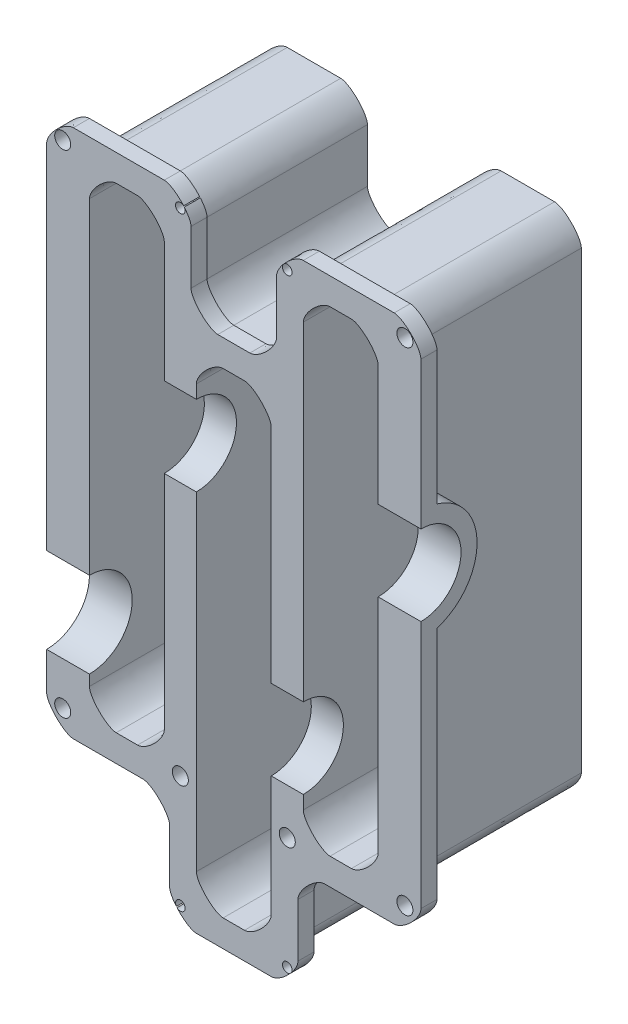
from build123d import *

# Parameters (mm, degrees)
SKETCH1_W           = 70
SKETCH1_H           = 119
BOSS_EXTRUDE1_DEPTH = 35
SKETCH2_R           = 8
CUT_EXTRUDE1_DEPTH  = 8
CUT_EXTRUDE2_DEPTH  = 32
SKETCH4_R           = 7.5
CUT_EXTRUDE3_DEPTH  = 8
SKETCH5_W           = 16
SKETCH5_H           = 20
SKETCH5_W_2         = 23
CUT_EXTRUDE4_DEPTH  = 78.396705356
CUT_EXTRUDE5_DEPTH  = 5
SKETCH8_W           = 18
SKETCH8_H           = 32
CUT_EXTRUDE6_DEPTH  = 2
SKETCH9_W           = 32
SKETCH9_H           = 22
CUT_EXTRUDE7_DEPTH  = 2
SKETCH10_W          = 22
SKETCH10_H          = 32
CUT_EXTRUDE8_DEPTH  = 2
SKETCH11_W          = 32
SKETCH11_H          = 18
CUT_EXTRUDE9_DEPTH  = 2
SKETCH12_W          = 25
SKETCH12_H          = 32
CUT_EXTRUDE10_DEPTH = 2
CUT_EXTRUDE11_DEPTH = 5
SKETCH14_W          = 22
SKETCH14_H          = 32
CUT_EXTRUDE12_DEPTH = 2
SKETCH15_W          = 22
SKETCH15_H          = 32
CUT_EXTRUDE13_DEPTH = 2
SKETCH16_W          = 16
SKETCH16_H          = 32
CUT_EXTRUDE14_DEPTH = 2
SKETCH17_W          = 32
SKETCH17_H          = 20
CUT_EXTRUDE15_DEPTH = 2
SKETCH18_W          = 32
SKETCH18_H          = 20
CUT_EXTRUDE17_DEPTH = 2
FILLET3_SIZE        = 5
FILLET5_SIZE        = 5
FILLET6_SIZE        = 5
FILLET7_START       = -1
FILLET7_DEPTH       = 33
FILLET7_2_DEPTH     = 32
FILLET11_SIZE       = 5
FILLET12_START      = 32
FILLET12_DEPTH      = 3
FILLET12_2_DEPTH    = 3
SKETCH19_R          = 1.5
CUT_EXTRUDE18_DEPTH = 10
SKETCH20_R          = 0.9
CUT_EXTRUDE19_DEPTH = 10
BOSS_EXTRUDE2_START = -6
BOSS_EXTRUDE2_DEPTH = 6
BOSS_EXTRUDE3_DEPTH = 6


with BuildPart() as part:
    # Sketch1 → Boss-Extrude1 (new body)
    with BuildSketch(Plane.XY):
        Rectangle(SKETCH1_W, SKETCH1_H)
    extrude(amount=BOSS_EXTRUDE1_DEPTH)

    # Sketch2 → Cut-Extrude1 (cut)
    with BuildSketch(Plane.ZY.offset(35)):
        with Locations((35, -19.5)):
            Circle(SKETCH2_R)
    extrude(amount=-CUT_EXTRUDE1_DEPTH, mode=Mode.SUBTRACT)

    # Sketch3 → Cut-Extrude2 (cut)
    with BuildSketch(Plane.XY.offset(35)):
        Polygon((-27, 54.5), (-13, 54.5), (-13, 27), (-7, 27), (-7, 34.5), (7, 34.5), (7, -12), (13, -12), (13, 54.5), (27, 54.5), (27, -34.5), (13, -34.5), (13, -27), (7, -27), (7, -54.5), (-7, -54.5), (-7, 12), (-13, 12), (-13, -34.5), (-27, -34.5), align=None)
    extrude(amount=-CUT_EXTRUDE2_DEPTH, mode=Mode.SUBTRACT)

    # Sketch4 → Cut-Extrude3 (cut)
    with BuildSketch(Plane(origin=(35, 0, 0), x_dir=(0, 0, -1), z_dir=(1, 0, 0))):
        with Locations((-35, 19.5)):
            Circle(SKETCH4_R)
    extrude(amount=-CUT_EXTRUDE3_DEPTH, mode=Mode.SUBTRACT)

    # Sketch5 → Cut-Extrude4 (cut, through all)
    with BuildSketch(Plane.XY.offset(35)):
        with Locations((0, 49.5)):
            Rectangle(SKETCH5_W, SKETCH5_H)
        with Locations((-23.5, -49.5)):
            Rectangle(SKETCH5_W_2, SKETCH5_H)
        with Locations((23.5, -49.5)):
            Rectangle(SKETCH5_W_2, SKETCH5_H)
    extrude(amount=-CUT_EXTRUDE4_DEPTH, mode=Mode.SUBTRACT)

    # Sketch7 → Cut-Extrude5 (cut)
    with BuildSketch(Plane.ZY.offset(35)):
        with BuildLine():
            Line((32, 59.5), (0, 59.5))
            Line((0, 59.5), (0, -39.5))
            Line((0, -39.5), (32, -39.5))
            Line((32, -39.5), (32, -30.083005244))
            ThreePointArc((32, -30.083005244), (24, -19.5), (32, -8.916994756))
            Line((32, -8.916994756), (32, 59.5))
        make_face()
    extrude(amount=-CUT_EXTRUDE5_DEPTH, mode=Mode.SUBTRACT)

    # Sketch8 → Cut-Extrude6 (cut)
    with BuildSketch(Plane.XZ.offset(39.5)):
        with Locations((-21, 16)):
            Rectangle(SKETCH8_W, SKETCH8_H)
    extrude(amount=-CUT_EXTRUDE6_DEPTH, mode=Mode.SUBTRACT)

    # Sketch9 → Cut-Extrude7 (cut)
    with BuildSketch(Plane.ZY.offset(12)):
        with Locations((16, -48.5)):
            Rectangle(SKETCH9_W, SKETCH9_H)
    extrude(amount=-CUT_EXTRUDE7_DEPTH, mode=Mode.SUBTRACT)

    # Sketch10 → Cut-Extrude8 (cut)
    with BuildSketch(Plane.XZ.offset(59.5)):
        with Locations((1, 16)):
            Rectangle(SKETCH10_W, SKETCH10_H)
    extrude(amount=-CUT_EXTRUDE8_DEPTH, mode=Mode.SUBTRACT)

    # Sketch11 → Cut-Extrude9 (cut)
    with BuildSketch(Plane(origin=(12, 0, 0), x_dir=(0, 0, -1), z_dir=(1, 0, 0))):
        with Locations((-16, -48.5)):
            Rectangle(SKETCH11_W, SKETCH11_H)
    extrude(amount=-CUT_EXTRUDE9_DEPTH, mode=Mode.SUBTRACT)

    # Sketch12 → Cut-Extrude10 (cut)
    with BuildSketch(Plane.XZ.offset(39.5)):
        with Locations((22.5, 16)):
            Rectangle(SKETCH12_W, SKETCH12_H)
    extrude(amount=-CUT_EXTRUDE10_DEPTH, mode=Mode.SUBTRACT)

    # Sketch13 → Cut-Extrude11 (cut)
    with BuildSketch(Plane(origin=(35, 0, 0), x_dir=(0, 0, -1), z_dir=(1, 0, 0))):
        with BuildLine():
            Line((0, -37.5), (-32, -37.5))
            Line((-32, -37.5), (-32, 9.437694101))
            ThreePointArc((-32, 9.437694101), (-24.5, 19.5), (-32, 29.562305899))
            Line((-32, 29.562305899), (-32, 59.5))
            Line((-32, 59.5), (0, 59.5))
            Line((0, 59.5), (0, -37.5))
        make_face()
    extrude(amount=-CUT_EXTRUDE11_DEPTH, mode=Mode.SUBTRACT)

    # Sketch14 → Cut-Extrude12 (cut)
    with BuildSketch(Plane(origin=(0, 59.5, 0), x_dir=(1, 0, 0), z_dir=(0, 1, 0))):
        with Locations((19, -16)):
            Rectangle(SKETCH14_W, SKETCH14_H)
    extrude(amount=-CUT_EXTRUDE12_DEPTH, mode=Mode.SUBTRACT)

    # Sketch15 → Cut-Extrude13 (cut)
    with BuildSketch(Plane(origin=(0, 59.5, 0), x_dir=(1, 0, 0), z_dir=(0, 1, 0))):
        with Locations((-19, -16)):
            Rectangle(SKETCH15_W, SKETCH15_H)
    extrude(amount=-CUT_EXTRUDE13_DEPTH, mode=Mode.SUBTRACT)

    # Sketch16 → Cut-Extrude14 (cut)
    with BuildSketch(Plane(origin=(0, 39.5, 0), x_dir=(1, 0, 0), z_dir=(0, 1, 0))):
        with Locations((0, -16)):
            Rectangle(SKETCH16_W, SKETCH16_H)
    extrude(amount=-CUT_EXTRUDE14_DEPTH, mode=Mode.SUBTRACT)

    # Sketch17 → Cut-Extrude15 (cut)
    with BuildSketch(Plane.ZY.offset(-8)):
        with Locations((16, 47.5)):
            Rectangle(SKETCH17_W, SKETCH17_H)
    extrude(amount=-CUT_EXTRUDE15_DEPTH, mode=Mode.SUBTRACT)

    # Sketch18 → Cut-Extrude17 (cut)
    with BuildSketch(Plane(origin=(-8, 0, 0), x_dir=(0, 0, -1), z_dir=(1, 0, 0))):
        with Locations((-16, 47.5)):
            Rectangle(SKETCH18_W, SKETCH18_H)
    extrude(amount=-CUT_EXTRUDE17_DEPTH, mode=Mode.SUBTRACT)

    # Fillet3
    # a fillet whose section is not a circle: 5 mm, written as the material it adds along each edge
    with BuildSketch(Plane(origin=(13, 54.5, 35), x_dir=(1, 0, 0), z_dir=(0, 0, -1)), Plane(origin=(-7, 34.5, 35), x_dir=(1, 0, 0), z_dir=(0, 0, -1))) as fillet3_piece_1:
        with BuildLine():
            Bezier((FILLET3_SIZE, 0), (0, 0), (0, FILLET3_SIZE), weights=[1, 0.353553391, 1])
            Line((0, FILLET3_SIZE), (0, 0))
            Line((0, 0), (FILLET3_SIZE, 0))
        make_face()
    extrude(amount=32)
    with BuildSketch(Plane(origin=(-27, 54.5, 35), x_dir=(0, -1, 0), z_dir=(0, 0, -1))) as fillet3_piece_2:
        with BuildLine():
            Bezier((FILLET3_SIZE, 0), (0, 0), (0, -FILLET3_SIZE), weights=[1, 0.353553391, 1])
            Line((0, -FILLET3_SIZE), (0, 0))
            Line((0, 0), (FILLET3_SIZE, 0))
        make_face()
    extrude(amount=32)

    # Fillet5
    # a fillet whose section is not a circle: 5 mm, written as the material it adds along each edge
    with BuildSketch(Plane(origin=(27, 54.5, 35), x_dir=(0, -1, 0), z_dir=(0, 0, -1)), Plane(origin=(7, 34.5, 35), x_dir=(0, -1, 0), z_dir=(0, 0, -1))) as fillet5_piece_1:
        with BuildLine():
            Bezier((FILLET5_SIZE, 0), (0, 0), (0, FILLET5_SIZE), weights=[1, 0.353553391, 1])
            Line((0, FILLET5_SIZE), (0, 0))
            Line((0, 0), (FILLET5_SIZE, 0))
        make_face()
    extrude(amount=32)
    with BuildSketch(Plane(origin=(-13, 54.5, 35), x_dir=(-1, 0, 0), z_dir=(0, 0, -1))) as fillet5_piece_2:
        with BuildLine():
            Bezier((FILLET5_SIZE, 0), (0, 0), (0, -FILLET5_SIZE), weights=[1, 0.353553391, 1])
            Line((0, -FILLET5_SIZE), (0, 0))
            Line((0, 0), (FILLET5_SIZE, 0))
        make_face()
    extrude(amount=32)

    # Fillet6
    # a fillet whose section is not a circle: 5 mm, written as the material it adds along each edge
    with BuildSketch(Plane(origin=(27, -34.5, 35), x_dir=(-1, 0, 0), z_dir=(0, 0, -1)), Plane(origin=(13, -34.5, 35), x_dir=(0, 1, 0), z_dir=(0, 0, -1)), Plane(origin=(7, -54.5, 35), x_dir=(-1, 0, 0), z_dir=(0, 0, -1)), Plane(origin=(-7, -54.5, 35), x_dir=(0, 1, 0), z_dir=(0, 0, -1)), Plane(origin=(-13, -34.5, 35), x_dir=(-1, 0, 0), z_dir=(0, 0, -1)), Plane(origin=(-27, -34.5, 35), x_dir=(0, 1, 0), z_dir=(0, 0, -1))) as fillet6_piece_1:
        with BuildLine():
            Bezier((FILLET6_SIZE, 0), (0, 0), (0, FILLET6_SIZE), weights=[1, 0.353553391, 1])
            Line((0, FILLET6_SIZE), (0, 0))
            Line((0, 0), (FILLET6_SIZE, 0))
        make_face()
    extrude(amount=32)

    # Fillet7: read off the stored shape, not the designer's step
    # Fillet7 outline → Fillet7 (cut)
    with BuildSketch(Plane.XY.offset(FILLET7_START)):
        with BuildLine():
            Line((-10, 57.5), (-15, 57.5))
            add(Edge.make_bspline(
                [(-15, 57.5), (-10, 57.5), (-10, 52.5)],
                knots=[0, 0, 0, 1, 1, 1], degree=2, weights=[1, 0.353553391, 1]))
            Line((-10, 52.5), (-10, 57.5))
        make_face()
        with BuildLine():
            add(Edge.make_bspline(
                [(-30, 52.5), (-30, 57.5), (-25, 57.5)],
                knots=[0, 0, 0, 1, 1, 1], degree=2, weights=[1, 0.353553391, 1]))
            Line((-25, 57.5), (-30, 57.5))
            Line((-30, 57.5), (-30, 52.5))
        make_face()
        with BuildLine():
            add(Edge.make_bspline(
                [(-25, -37.5), (-30, -37.5), (-30, -32.5)],
                knots=[0, 0, 0, 1, 1, 1], degree=2, weights=[1, 0.353553391, 1]))
            Line((-30, -32.5), (-30, -37.5))
            Line((-30, -37.5), (-25, -37.5))
        make_face()
        with BuildLine():
            Line((10, 57.5), (10, 52.5))
            add(Edge.make_bspline(
                [(10, 52.5), (10, 57.5), (15, 57.5)],
                knots=[0, 0, 0, 1, 1, 1], degree=2, weights=[1, 0.353553391, 1]))
            Line((15, 57.5), (10, 57.5))
        make_face()
        with BuildLine():
            add(Edge.make_bspline(
                [(-10, -52.5), (-10, -57.5), (-5, -57.5)],
                knots=[0, 0, 0, 1, 1, 1], degree=2, weights=[1, 0.353553391, 1]))
            Line((-10, -52.5), (-10, -57.5))
            Line((-10, -57.5), (-5, -57.5))
        make_face()
        with BuildLine():
            Line((30, 57.5), (25, 57.5))
            add(Edge.make_bspline(
                [(25, 57.5), (30, 57.5), (30, 52.5)],
                knots=[0, 0, 0, 1, 1, 1], degree=2, weights=[1, 0.353553391, 1]))
            Line((30, 52.5), (30, 57.5))
        make_face()
        with BuildLine():
            add(Edge.make_bspline(
                [(5, -57.5), (10, -57.5), (10, -52.5)],
                knots=[0, 0, 0, 1, 1, 1], degree=2, weights=[1, 0.353553391, 1]))
            Line((5, -57.5), (10, -57.5))
            Line((10, -57.5), (10, -52.5))
        make_face()
        with BuildLine():
            Line((30, -37.5), (30, -32.5))
            add(Edge.make_bspline(
                [(30, -32.5), (30, -37.5), (25, -37.5)],
                knots=[0, 0, 0, 1, 1, 1], degree=2, weights=[1, 0.353553391, 1]))
            Line((25, -37.5), (30, -37.5))
        make_face()
    extrude(amount=FILLET7_DEPTH, mode=Mode.SUBTRACT)

    # Fillet7 2 outline → Fillet7 2 (add)
    with BuildSketch(Plane.XY):
        with BuildLine():
            add(Edge.make_bspline(
                [(-5, 37.5), (-10, 37.5), (-10, 42.5)],
                knots=[0, 0, 0, 1, 1, 1], degree=2, weights=[1, 0.353553391, 1]))
            Line((-10, 42.5), (-10, 37.5))
            Line((-10, 37.5), (-5, 37.5))
        make_face()
        with BuildLine():
            add(Edge.make_bspline(
                [(5, 37.5), (10, 37.5), (10, 42.5)],
                knots=[0, 0, 0, 1, 1, 1], degree=2, weights=[1, 0.353553391, 1]))
            Line((5, 37.5), (10, 37.5))
            Line((10, 37.5), (10, 42.5))
        make_face()
        with BuildLine():
            Line((-10, -37.5), (-15, -37.5))
            add(Edge.make_bspline(
                [(-10, -42.5), (-10, -37.5), (-15, -37.5)],
                knots=[0, 0, 0, 1, 1, 1], degree=2, weights=[1, 0.353553391, 1]))
            Line((-10, -42.5), (-10, -37.5))
        make_face()
        with BuildLine():
            Line((10, -37.5), (10, -42.5))
            add(Edge.make_bspline(
                [(15, -37.5), (10, -37.5), (10, -42.5)],
                knots=[0, 0, 0, 1, 1, 1], degree=2, weights=[1, 0.353553391, 1]))
            Line((15, -37.5), (10, -37.5))
        make_face()
    extrude(amount=FILLET7_2_DEPTH)

    # Fillet11
    # a fillet whose section is not a circle: 5 mm, written as the material it takes off along each edge
    with BuildSketch(Plane(origin=(35, -39.5, 47.5), x_dir=(0, 1, 0), z_dir=(0, 0, -1))) as fillet11_piece_1:
        with BuildLine():
            Bezier((FILLET11_SIZE, 0), (0, 0), (0, -FILLET11_SIZE), weights=[1, 0.353553391, 1])
            Line((0, -FILLET11_SIZE), (0, 0))
            Line((0, 0), (FILLET11_SIZE, 0))
        make_face()
    extrude(amount=28, mode=Mode.SUBTRACT)

    # Fillet12: read off the stored shape, not the designer's step
    # Fillet12 outline → Fillet12 (cut)
    with BuildSketch(Plane.XY.offset(FILLET12_START)):
        with BuildLine():
            Line((35, 59.5), (30, 59.5))
            add(Edge.make_bspline(
                [(30, 59.5), (35, 59.5), (35, 54.5)],
                knots=[0, 0, 0, 1, 1, 1], degree=2, weights=[1, 0.353553391, 1]))
            Line((35, 54.5), (35, 59.5))
        make_face()
        with BuildLine():
            Line((8, 59.5), (8, 54.5))
            add(Edge.make_bspline(
                [(13, 59.5), (8, 59.5), (8, 54.5)],
                knots=[0, 0, 0, 1, 1, 1], degree=2, weights=[1, 0.353553391, 1]))
            Line((13, 59.5), (8, 59.5))
        make_face()
        with BuildLine():
            add(Edge.make_bspline(
                [(7, -59.5), (12, -59.5), (12, -54.5)],
                knots=[0, 0, 0, 1, 1, 1], degree=2, weights=[1, 0.353553391, 1]))
            Line((7, -59.5), (12, -59.5))
            Line((12, -59.5), (12, -54.5))
        make_face()
        with BuildLine():
            add(Edge.make_bspline(
                [(-12, -54.5), (-12, -59.5), (-7, -59.5)],
                knots=[0, 0, 0, 1, 1, 1], degree=2, weights=[1, 0.353553391, 1]))
            Line((-12, -54.5), (-12, -59.5))
            Line((-12, -59.5), (-7, -59.5))
        make_face()
        with BuildLine():
            add(Edge.make_bspline(
                [(-35, -34.5), (-35, -39.5), (-30, -39.5)],
                knots=[0, 0, 0, 1, 1, 1], degree=2, weights=[1, 0.353553391, 1]))
            Line((-35, -34.5), (-35, -39.5))
            Line((-35, -39.5), (-30, -39.5))
        make_face()
        with BuildLine():
            add(Edge.make_bspline(
                [(-35, 54.5), (-35, 59.5), (-30, 59.5)],
                knots=[0, 0, 0, 1, 1, 1], degree=2, weights=[1, 0.353553391, 1]))
            Line((-30, 59.5), (-35, 59.5))
            Line((-35, 59.5), (-35, 54.5))
        make_face()
        with BuildLine():
            add(Edge.make_bspline(
                [(-8, 54.5), (-8, 59.5), (-13, 59.5)],
                knots=[0, 0, 0, 1, 1, 1], degree=2, weights=[1, 0.353553391, 1]))
            Line((-8, 54.5), (-8, 59.5))
            Line((-8, 59.5), (-13, 59.5))
        make_face()
    extrude(amount=FILLET12_DEPTH, mode=Mode.SUBTRACT)

    # Fillet12 2 outline → Fillet12 2 (add)
    with BuildSketch(Plane.XY.offset(FILLET12_START)):
        with BuildLine():
            add(Edge.make_bspline(
                [(3, 39.5), (8, 39.5), (8, 44.5)],
                knots=[0, 0, 0, 1, 1, 1], degree=2, weights=[1, 0.353553391, 1]))
            Line((3, 39.5), (8, 39.5))
            Line((8, 39.5), (8, 44.5))
        make_face()
        with BuildLine():
            Line((12, -39.5), (12, -44.5))
            add(Edge.make_bspline(
                [(17, -39.5), (12, -39.5), (12, -44.5)],
                knots=[0, 0, 0, 1, 1, 1], degree=2, weights=[1, 0.353553391, 1]))
            Line((17, -39.5), (12, -39.5))
        make_face()
        with BuildLine():
            Line((-12, -39.5), (-17, -39.5))
            add(Edge.make_bspline(
                [(-12, -44.5), (-12, -39.5), (-17, -39.5)],
                knots=[0, 0, 0, 1, 1, 1], degree=2, weights=[1, 0.353553391, 1]))
            Line((-12, -44.5), (-12, -39.5))
        make_face()
        with BuildLine():
            add(Edge.make_bspline(
                [(-8, 44.5), (-8, 39.5), (-3, 39.5)],
                knots=[0, 0, 0, 1, 1, 1], degree=2, weights=[1, 0.353553391, 1]))
            Line((-8, 44.5), (-8, 39.5))
            Line((-8, 39.5), (-3, 39.5))
        make_face()
    extrude(amount=FILLET12_2_DEPTH)

    # Sketch19 → Cut-Extrude18 (cut)
    with BuildSketch(Plane.XY.offset(35)):
        with Locations((-32, 56.5)):
            Circle(SKETCH19_R)
        with Locations((32, 56.5)):
            Circle(SKETCH19_R)
        with Locations((32, -35.5)):
            Circle(SKETCH19_R)
        with Locations((-32, -35.5)):
            Circle(SKETCH19_R)
        with Locations((-10, -35.5)):
            Circle(SKETCH19_R)
        with Locations((10, -35.5)):
            Circle(SKETCH19_R)
    extrude(amount=-CUT_EXTRUDE18_DEPTH, mode=Mode.SUBTRACT)

    # Sketch20 → Cut-Extrude19 (cut)
    with BuildSketch(Plane.XY.offset(35)):
        with Locations((-10, 56.5)):
            Circle(SKETCH20_R)
        with Locations((10, 56.5)):
            Circle(SKETCH20_R)
        with Locations((10, -56.5)):
            Circle(SKETCH20_R)
        with Locations((-10, -56.5)):
            Circle(SKETCH20_R)
    extrude(amount=-CUT_EXTRUDE19_DEPTH, mode=Mode.SUBTRACT)

    # Sketch22 → Boss-Extrude2 (add)
    with BuildSketch(Plane.ZY.offset(13).offset(BOSS_EXTRUDE2_START)):
        with BuildLine():
            Line((35, 27), (3, 27))
            Line((3, 27), (3, 12))
            Line((3, 12), (35, 12))
            ThreePointArc((35, 12), (27.5, 19.5), (35, 27))
        make_face()
    extrude(amount=BOSS_EXTRUDE2_DEPTH)

    # Sketch23 → Boss-Extrude3 (add)
    with BuildSketch(Plane(origin=(13, 0, 0), x_dir=(0, 0, -1), z_dir=(1, 0, 0))):
        with BuildLine():
            Line((-35, -12), (-3, -12))
            Line((-3, -12), (-3, -27))
            Line((-3, -27), (-35, -27))
            ThreePointArc((-35, -27), (-27.5, -19.5), (-35, -12))
        make_face()
    extrude(amount=-BOSS_EXTRUDE3_DEPTH)


solid = part.part
